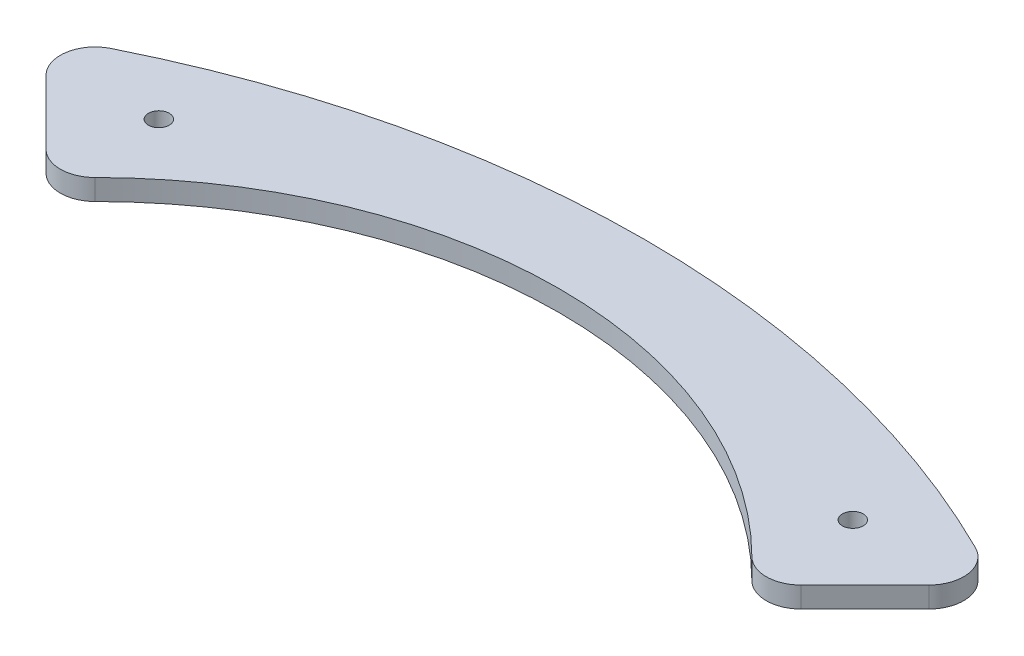
from build123d import *

# Parameters (mm, degrees)
BOSS_EXTRUDE1_DEPTH = 3
FILLET1_R           = 5
CUT_EXTRUDE1_REACH  = 156.417
SKETCH2_R           = 1.5


with BuildPart() as part:
    # Sketch1 → Boss-Extrude1 (new body)
    with BuildSketch(Plane(origin=(0, 0, 0), x_dir=(1, 0, 0), z_dir=(0, 1, 0))):
        with BuildLine():
            Line((-68.408481347, 122.148596717), (-50.730811817, 104.470927187))
            ThreePointArc((-50.730811817, 104.470927187), (0, 127.705818568), (50.730811817, 104.470927187))
            Line((50.730811817, 104.470927187), (68.408481347, 122.148596717))
            ThreePointArc((68.408481347, 122.148596717), (0, 140), (-68.408481347, 122.148596717))
        make_face()
    extrude(amount=BOSS_EXTRUDE1_DEPTH)

    # Fillet1
    fillet1_edges = [part.edges().sort_by_distance(p)[0] for p in [
        (68.408481347, 1.5, -122.148596717),
        (50.730811817, 1.5, -104.470927187),
        (-68.408481347, 1.5, -122.148596717),
        (-50.730811817, 1.5, -104.470927187),
    ]]
    fillet(fillet1_edges, radius=FILLET1_R)

    # Sketch2 → Cut-Extrude1 (cut, up to next)
    with BuildSketch(Plane(origin=(0, 3, 0), x_dir=(1, 0, 0), z_dir=(0, 1, 0)), mode=Mode.PRIVATE) as cut_extrude1_sk1:
        with Locations((-50, 120)):
            Circle(SKETCH2_R)
    cut_extrude1_tool1 = extrude(cut_extrude1_sk1.sketch, amount=-CUT_EXTRUDE1_REACH, mode=Mode.PRIVATE) & part.part
    # Sketch2 → Cut-Extrude1 (cut, up to next)
    with BuildSketch(Plane(origin=(0, 3, 0), x_dir=(1, 0, 0), z_dir=(0, 1, 0)), mode=Mode.PRIVATE) as cut_extrude1_sk2:
        with Locations((50, 120)):
            Circle(SKETCH2_R)
    cut_extrude1_tool2 = extrude(cut_extrude1_sk2.sketch, amount=-CUT_EXTRUDE1_REACH, mode=Mode.PRIVATE) & part.part
    add(cut_extrude1_tool1.solids().sort_by_distance((-50, 3, -120))[0], mode=Mode.SUBTRACT)
    add(cut_extrude1_tool2.solids().sort_by_distance((50, 3, -120))[0], mode=Mode.SUBTRACT)


solid = part.part
